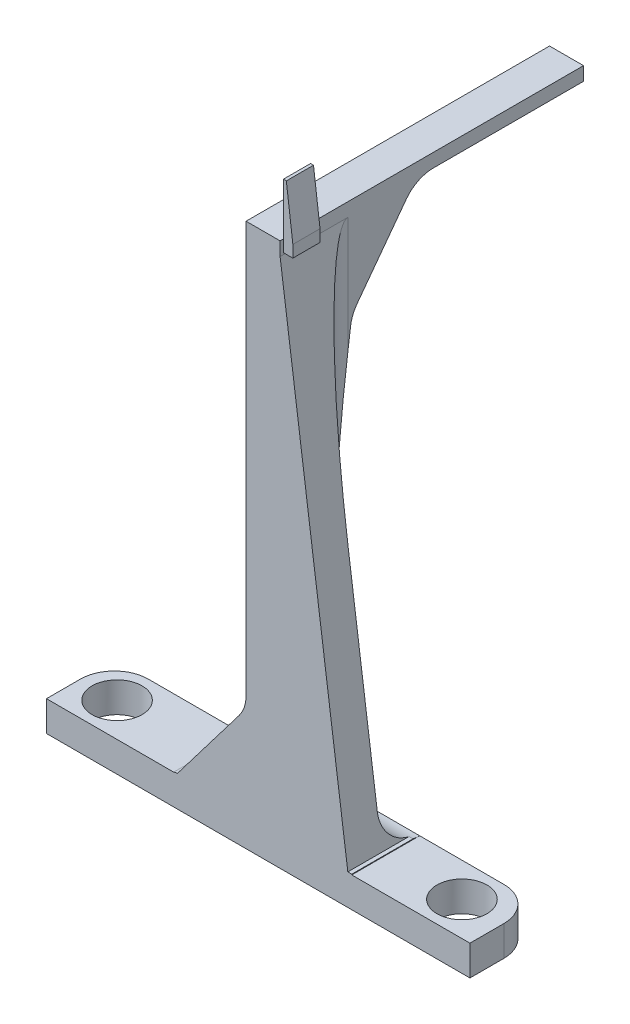
from build123d import *

# Parameters (mm, degrees)
BOSS_EXTRUDE3_START = 40
BOSS_EXTRUDE3_DEPTH = 4
SKETCH3_W           = 5.009740145
SKETCH3_H           = 44.698182912
BOSS_EXTRUDE4_DEPTH = 2
BOSS_EXTRUDE5_DEPTH = 5
SKETCH7_W           = 62.374089496
SKETCH7_H           = 4.444300198
BOSS_EXTRUDE6_DEPTH = 10
SKETCH8_R           = 3.68
CUT_EXTRUDE1_DEPTH  = 10
BOSS_EXTRUDE7_DEPTH = 2
FILLET1_R           = 5


with BuildPart() as part:
    # Sketch4 → Boss-Extrude3 (new body)
    with BuildSketch(Plane.XY.offset(BOSS_EXTRUDE3_START)):
        Polygon((82.266178214, 7.62), (82.696382378, 7.62), (83.657798078, 0), (83.657798078, -1.756584044), (77.202578377, -1.756584044), (77.256438069, 0), (82.266178214, 0), align=None)
    extrude(amount=BOSS_EXTRUDE3_DEPTH)

    # Sketch3 → Boss-Extrude4 (add)
    with BuildSketch(Plane(origin=(0, 0, 0), x_dir=(1, 0, 0), z_dir=(0, 1, 0))):
        with Locations((79.761308141, -22.142555967)):
            Rectangle(SKETCH3_W, SKETCH3_H)
    extrude(amount=-BOSS_EXTRUDE4_DEPTH)

    # Sketch6 → Boss-Extrude5 (add)
    with BuildSketch(Plane.XY.offset(44.491647423)):
        Polygon((77.256438069, -2), (77.256438069, -3.040359502), (77.256438069, -62.213081923), (67.137259184, -75.509161123), (66.697097711, -75.509161123), (66.697097711, -80.05237461), (92.826264311, -80.05237461), (92.826264311, -75.509161123), (92.244616978, -75.509161123), (82.266178214, -2), align=None)
    extrude(amount=-BOSS_EXTRUDE5_DEPTH)

    # Sketch7 → Boss-Extrude6 (add)
    with BuildSketch(Plane.XY.offset(44.491647423)):
        with Locations((79.043692129, -77.830224511)):
            Rectangle(SKETCH7_W, SKETCH7_H)
    extrude(amount=-BOSS_EXTRUDE6_DEPTH)

    # Sketch8 → Cut-Extrude1 (cut)
    with BuildSketch(Plane(origin=(0, -75.608074412, 0), x_dir=(1, 0, 0), z_dir=(0, 1, 0))):
        with Locations(Location((53.253735199, -39.491647423, 0), (0, 0, 270))):
            Circle(SKETCH8_R)
        with Locations(Location((104.053735199, -39.491647423, 0), (0, 0, 270))):
            Circle(SKETCH8_R)
    extrude(amount=-CUT_EXTRUDE1_DEPTH, mode=Mode.SUBTRACT)

    # Sketch9 → Boss-Extrude7 (add)
    with BuildSketch(Plane(origin=(82.266178214, 0, 0), x_dir=(0, 0, -1), z_dir=(1, 0, 0))):
        Polygon((-24.429530022, -2), (-33.920992071, -14.725861543), (-39.491647423, -56.549410739), (-39.491647423, -2), align=None)
    extrude(amount=-BOSS_EXTRUDE7_DEPTH)

    # Fillet1
    # the kernel refuses this fillet: 5 mm, written as the material it adds along each edge
    with BuildSketch(Plane(origin=(82.266178214, -69.049410739, 39.491647423), x_dir=(0, 0, -1), z_dir=(0, 1, 0))) as fillet1_piece_1_section:
        with BuildLine():
            CenterArc((FILLET1_R, -FILLET1_R), FILLET1_R, 90, 90)
            Line((0, -FILLET1_R), (0, 0))
            Line((0, 0), (FILLET1_R, 0))
        make_face()
    fillet1_piece_1 = extrude(amount=79.549410739, mode=Mode.PRIVATE)
    fillet1_piece_1 = split(fillet1_piece_1, bisect_by=Plane(origin=(91.203068258, -67.836280176, 39.491647423), z_dir=(-0.9909121640469413, -0.13451053172078273, 0)), keep=Keep.TOP, mode=Mode.PRIVATE)
    fillet1_piece_1 = split(fillet1_piece_1, bisect_by=Plane(origin=(82.266178214, -68.831517537, 41.127553158), z_dir=(0, 0.13202823988691362, 0.9912459552867612)), keep=Keep.TOP, mode=Mode.PRIVATE)
    add(fillet1_piece_1)
    with BuildSketch(Plane(origin=(82.266178214, -2, 24.429530022), x_dir=(0, 0, -1), z_dir=(-1, 0, 0))) as fillet1_piece_2:
        with BuildLine():
            CenterArc((FILLET1_R * 0.501668266059, FILLET1_R), FILLET1_R, 216.717064356, 53.282935644)
            Line((-FILLET1_R * 0.299929352407, FILLET1_R * 0.402136087333), (0, 0))
            Line((0, 0), (FILLET1_R * 0.501668266059, 0))
        make_face()
    extrude(amount=2)
    with BuildSketch(Plane(origin=(82.266178214, -14.725861543, 33.920992071), x_dir=(0, 0.8015976184662758, -0.5978639126667499), z_dir=(-1, 0, 0))) as fillet1_piece_3:
        with BuildLine():
            CenterArc((FILLET1_R * 0.259830628617, FILLET1_R), FILLET1_R, 240.869747944, 29.130252056)
            Line((-FILLET1_R * 0.226966033962, FILLET1_R * 0.126484682847), (0, 0))
            Line((0, 0), (FILLET1_R * 0.259830628617, 0))
        make_face()
    extrude(amount=2)
    with BuildSketch(Plane(origin=(80.266178214, -68.016446568, 39.491647423), x_dir=(-1, 0, 0), z_dir=(0, 1, 0))) as fillet1_piece_4_section:
        with BuildLine():
            CenterArc((5, -4.586814331), FILLET1_R, 113.456454131, 66.543545869)
            Line((0, -4.586814331), (0, 0))
            Line((0, 0), (3.009740145, 0))
        make_face()
    fillet1_piece_4 = extrude(amount=66.016446568, mode=Mode.PRIVATE)
    fillet1_piece_4 = split(fillet1_piece_4, bisect_by=Plane(origin=(80.266178214, -67.816559436, 40.992366597), z_dir=(0, 0.13202823988691362, 0.9912459552867612)), keep=Keep.TOP, mode=Mode.PRIVATE)
    add(fillet1_piece_4)
    with BuildSketch(Plane(origin=(77.256438069, -62.213081923, 44.491647423), x_dir=(0, 1, 0), z_dir=(0, 0, -1))) as fillet1_piece_5:
        with BuildLine():
            CenterArc((FILLET1_R * 0.337251278502, -FILLET1_R), FILLET1_R, 90, 37.273488701)
            Line((-FILLET1_R * 0.268368983809, -FILLET1_R * 0.204246207751), (0, 0))
            Line((0, 0), (FILLET1_R * 0.337251278502, 0))
        make_face()
    extrude(amount=5)
    with BuildSketch(Plane(origin=(66.697097711, -75.608074412, 39.491647423), x_dir=(0, 1, 0), z_dir=(1, 0, 0))) as fillet1_piece_6_section:
        with BuildLine():
            CenterArc((FILLET1_R, -FILLET1_R), FILLET1_R, 90, 90)
            Line((0, -FILLET1_R), (0, 0))
            Line((0, 0), (FILLET1_R, 0))
        make_face()
    fillet1_piece_6 = extrude(amount=26.1291666, mode=Mode.PRIVATE)
    fillet1_piece_6 = split(fillet1_piece_6, bisect_by=Plane(origin=(66.697097711, -75.509161123, 39.491647423), z_dir=(0, -1, 0)), keep=Keep.TOP, mode=Mode.PRIVATE)
    add(fillet1_piece_6)
    with BuildSketch(Plane(origin=(54.197097711, -75.608074412, 39.491647423), x_dir=(0, 1, 0), z_dir=(1, 0, 0))) as fillet1_piece_7_section:
        with BuildLine():
            CenterArc((FILLET1_R, -FILLET1_R), FILLET1_R, 90, 90)
            Line((0, -FILLET1_R), (0, 0))
            Line((0, 0), (FILLET1_R, 0))
        make_face()
    fillet1_piece_7 = extrude(amount=51.1291666, mode=Mode.PRIVATE)
    fillet1_piece_7 = split(fillet1_piece_7, bisect_by=Plane(origin=(91.569404015, -70.535002372, 39.491647423), z_dir=(-0.9909121640469413, -0.13451053172078273, 0)), keep=Keep.TOP, mode=Mode.PRIVATE)
    fillet1_piece_7 = split(fillet1_piece_7, bisect_by=Plane(origin=(62.343451037, -81.807977807, 39.491647423), z_dir=(0.7957537922487953, -0.6056202623110138, 0)), keep=Keep.TOP, mode=Mode.PRIVATE)
    add(fillet1_piece_7)
    # the kernel refuses this fillet: 5 mm, written as the material it takes off along each edge
    with BuildSketch(Plane(origin=(47.856647381, -92.55237461, 34.491647423), x_dir=(1, 0, 0), z_dir=(0, 1, 0))) as fillet1_2_piece_1:
        with BuildLine():
            CenterArc((FILLET1_R, -FILLET1_R), FILLET1_R, 90, 90)
            Line((0, -FILLET1_R), (0, 0))
            Line((0, 0), (FILLET1_R, 0))
        make_face()
    extrude(amount=29.444300198, mode=Mode.SUBTRACT)
    with BuildSketch(Plane(origin=(110.230736877, -63.108074412, 34.491647423), x_dir=(0, 0, 1), z_dir=(0, -1, 0))) as fillet1_2_piece_2:
        with BuildLine():
            CenterArc((FILLET1_R, FILLET1_R), FILLET1_R, 180, 90)
            Line((0, FILLET1_R), (0, 0))
            Line((0, 0), (FILLET1_R, 0))
        make_face()
    extrude(amount=29.444300198, mode=Mode.SUBTRACT)


solid = part.part
